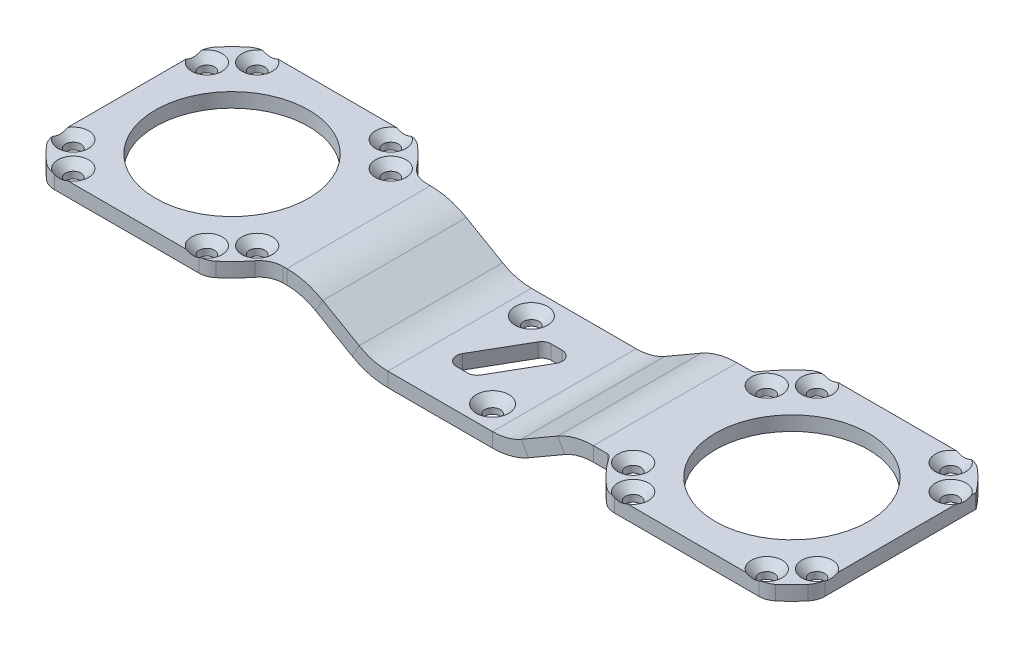
from build123d import *

# Parameters (mm, degrees)
SM_BASE_FLANGE_3_DEPTH       = 3
OTHER_START                  = -3
OTHER_2_DEPTH                = 3
OTHER_START_2                = 5
OTHER_2_2_DEPTH              = 3
OTHER_START_3                = -22
OTHER_2_3_DEPTH              = 44
OTHER_START_4                = -15
OTHER_2_4_DEPTH              = 30
OTHER_START_5                = -4
OTHER_2_5_DEPTH              = 9
OTHER_2_6_DEPTH              = 3
OTHER_2_7_DEPTH              = 3
SKETCH_15_R                  = 16
CUT_EXTRUDE_1_DEPTH          = 50
OTHER_4_DEPTH                = 44
OTHER_4_2_DEPTH              = 44
OTHER_START_6                = -11
OTHER_4_3_OUTLINE_R          = 16
OTHER_4_3_DEPTH              = 11
SKETCH_31_R                  = 1.4
CUT_EXTRUDE_2_DEPTH          = 10
CUT_EXTRUDE_5_DEPTH          = 56
FILLET_2_R                   = 2
FILLET_7_R                   = 4
FILLET_8_R                   = 5
FILLET_9_R                   = 1
SKETCH_45_R                  = 1.6
CUT_EXTRUDE_6_DEPTH          = 10
HOLE_WIZARD_M3_3_D           = 3.2
HOLE_WIZARD_M3_3_DEPTH       = 3
HOLE_WIZARD_M3_3_CSINK_D     = 6.4
HOLE_WIZARD_M3_3_CSINK_ANGLE = 90
HOLE_WIZARD_M3_3_TIP         = 0.96137699
HOLE_WIZARD_M3_2_D           = 3.2
HOLE_WIZARD_M3_2_DEPTH       = 3.3
HOLE_WIZARD_M3_2_CSINK_D     = 6.8
HOLE_WIZARD_M3_2_CSINK_ANGLE = 90
HOLE_WIZARD_M3_2_TIP         = 0.96137699


with BuildPart() as part:
    # 基体-法兰3: sheet metal written as solids
    # Sketch 1 → 基体-法兰3 (new body)
    with BuildSketch(Plane(origin=(0, 0, 0), x_dir=(1, 0, 0), z_dir=(0, 1, 0))):
        with BuildLine():
            Line((23.048861143, 15), (93.951138857, 15))
            ThreePointArc((93.951138857, 15), (96.91821461, 18.787546289), (100.5, 22))
            Line((100.5, 22), (133.5, 22))
            ThreePointArc((133.5, 22), (136.445436483, 19.445436483), (139, 16.5))
            Line((139, 16.5), (139, -16.5))
            ThreePointArc((139, -16.5), (136.445436483, -19.445436483), (133.5, -22))
            Line((133.5, -22), (100.5, -22))
            ThreePointArc((100.5, -22), (96.91821461, -18.787546289), (93.951138857, -15))
            Line((93.951138857, -15), (23.048861143, -15))
            ThreePointArc((23.048861143, -15), (20.08178539, -18.787546289), (16.5, -22))
            Line((16.5, -22), (-16.5, -22))
            ThreePointArc((-16.5, -22), (-19.445436483, -19.445436483), (-22, -16.5))
            Line((-22, -16.5), (-22, 16.5))
            ThreePointArc((-22, 16.5), (-19.445436483, 19.445436483), (-16.5, 22))
            Line((-16.5, 22), (16.5, 22))
            ThreePointArc((16.5, 22), (20.08178539, 18.787546289), (23.048861143, 15))
        make_face()
    extrude(amount=-SM_BASE_FLANGE_3_DEPTH)

    # Other 2: read off the stored shape, not the designer's step
    # Other 2 outline → Other 2 (cut)
    with BuildSketch(Plane(origin=(0, 0, 0), x_dir=(1, 0, 0), z_dir=(0, 1, 0)).offset(OTHER_START)):
        with BuildLine():
            ThreePointArc((-20.188495911, 16.5), (-17.633932394, 19.445436482), (-14.688495911, 22))
            Line((-14.688495911, 22), (-16.5, 22))
            ThreePointArc((-16.5, 22), (-19.445436483, 19.445436483), (-22, 16.5))
            Line((-22, 16.5), (-22, -16.5))
            ThreePointArc((-22, -16.5), (-19.445436483, -19.445436483), (-16.5, -22))
            Line((-16.5, -22), (-14.688495911, -22))
            ThreePointArc((-14.688495911, -22), (-17.633932393, -19.445436482), (-20.188495911, -16.5))
            Line((-20.188495911, -16.5), (-20.188495911, 16.5))
        make_face()
    extrude(amount=OTHER_2_DEPTH, mode=Mode.SUBTRACT)

    # Other 2 3 outline → Other 2 3 (cut)
    with BuildSketch(Plane.XY.offset(OTHER_START_3)):
        with BuildLine():
            Line((41.86824701, -0.990381057), (40.1528567, 0))
            Line((40.1528567, 0), (-20.188495911, 0))
            Line((-20.188495911, 0), (-20.188495911, -3))
            Line((-20.188495911, -3), (49.36824701, -3))
            ThreePointArc((49.36824701, -3), (45.485961334, -2.488887394), (41.86824701, -0.990381057))
        make_face()
    extrude(amount=OTHER_2_3_DEPTH, mode=Mode.SUBTRACT)



with BuildPart() as body_2:
    # Other 2 2 outline → Other 2 2 (new body)
    with BuildSketch(Plane(origin=(0, 0, 0), x_dir=(1, 0, 0), z_dir=(0, 1, 0)).offset(OTHER_START_2)):
        with BuildLine():
            Line((23.048861143, 15), (24.860365233, 15))
            ThreePointArc((24.860365233, 15), (21.893289479, 18.787546289), (18.311504089, 22))
            Line((18.311504089, 22), (16.5, 22))
            ThreePointArc((16.5, 22), (20.08178539, 18.787546289), (23.048861143, 15))
        make_face()
        with BuildLine():
            ThreePointArc((23.048861143, -15), (20.08178539, -18.787546289), (16.5, -22))
            Line((16.5, -22), (18.311504089, -22))
            ThreePointArc((18.311504089, -22), (21.893289479, -18.787546289), (24.860365233, -15))
            Line((24.860365233, -15), (23.048861143, -15))
        make_face()
    extrude(amount=OTHER_2_2_DEPTH)


with BuildPart() as part_1:
    add(part.part)

    add(body_2.part)  # Other 2 4 merges body 2
    # Other 2 4 outline → Other 2 4 (add)
    with BuildSketch(Plane.XY.offset(OTHER_START_4)):
        with BuildLine():
            ThreePointArc((49.36824701, 0), (46.262418469, 0.408890085), (43.36824701, 1.607695155))
            Line((43.36824701, 1.607695155), (35.777212354, 5.990381057))
            ThreePointArc((35.777212354, 5.990381057), (32.15949803, 7.488887394), (28.277212354, 8))
            Line((28.277212354, 8), (-20.188495911, 8))
            Line((-20.188495911, 8), (-20.188495911, 5))
            Line((-20.188495911, 5), (28.277212354, 5))
            ThreePointArc((28.277212354, 5), (31.383040895, 4.591109915), (34.277212354, 3.392304845))
            Line((34.277212354, 3.392304845), (40.1528567, 0))
            Line((40.1528567, 0), (49.36824701, 0))
        make_face()
    extrude(amount=OTHER_2_4_DEPTH)

    # Other 2 5 outline → Other 2 5 (cut)
    with BuildSketch(Plane(origin=(0, 0, 0), x_dir=(1, 0, 0), z_dir=(0, 1, 0)).offset(OTHER_START_5)):
        with BuildLine():
            ThreePointArc((100.5, 22), (96.91821461, 18.787546289), (93.951138857, 15))
            Line((93.951138857, 15), (95.762642946, 15))
            ThreePointArc((95.762642946, 15), (98.7297187, 18.787546289), (102.311504089, 22))
            Line((102.311504089, 22), (100.5, 22))
        make_face()
        with BuildLine():
            Line((95.762642946, -15), (93.951138857, -15))
            ThreePointArc((93.951138857, -15), (96.91821461, -18.787546289), (100.5, -22))
            Line((100.5, -22), (102.311504089, -22))
            ThreePointArc((102.311504089, -22), (98.7297187, -18.787546289), (95.762642946, -15))
        make_face()
    extrude(amount=OTHER_2_5_DEPTH, mode=Mode.SUBTRACT)

    # Other 2 6 outline → Other 2 6 (add)
    with BuildSketch(Plane(origin=(0, 0, 0), x_dir=(1, 0, 0), z_dir=(0, 1, 0)).offset(OTHER_START_2)):
        with BuildLine():
            Line((16.5, 22), (-14.688495911, 22))
            ThreePointArc((-14.688495911, 22), (-17.633932394, 19.445436482), (-20.188495911, 16.5))
            Line((-20.188495911, 16.5), (-20.188495911, 15))
            Line((-20.188495911, 15), (23.048861143, 15))
            ThreePointArc((23.048861143, 15), (20.08178539, 18.787546289), (16.5, 22))
        make_face()
        with BuildLine():
            Line((23.048861143, -15), (-20.188495911, -15))
            Line((-20.188495911, -15), (-20.188495911, -16.5))
            ThreePointArc((-20.188495911, -16.5), (-17.633932393, -19.445436482), (-14.688495911, -22))
            Line((-14.688495911, -22), (16.5, -22))
            ThreePointArc((16.5, -22), (20.08178539, -18.787546289), (23.048861143, -15))
        make_face()
    extrude(amount=OTHER_2_6_DEPTH)

    # Other 2 7 outline → Other 2 7 (add)
    with BuildSketch(Plane(origin=(0, 0, 0), x_dir=(1, 0, 0), z_dir=(0, 1, 0)).offset(OTHER_START)):
        with BuildLine():
            Line((135.311504089, 22), (133.5, 22))
            ThreePointArc((133.5, 22), (136.445436483, 19.445436483), (139, 16.5))
            Line((139, 16.5), (139, -16.5))
            ThreePointArc((139, -16.5), (136.445436483, -19.445436483), (133.5, -22))
            Line((133.5, -22), (135.311504089, -22))
            ThreePointArc((135.311504089, -22), (138.256940572, -19.445436483), (140.811504089, -16.5))
            Line((140.811504089, -16.5), (140.811504089, 16.5))
            ThreePointArc((140.811504089, 16.5), (138.256940572, 19.445436483), (135.311504089, 22))
        make_face()
    extrude(amount=OTHER_2_7_DEPTH)

    # 草图15 → 切除-拉伸1 (cut)
    with BuildSketch(Plane(origin=(0, 8, 0), x_dir=(1, 0, 0), z_dir=(0, 1, 0))):
        with Locations(Location((118.811504089, 0, 0), (0, 0, 270))):
            Circle(SKETCH_15_R)
        with Locations(Location((1.811504089, 0, 0), (0, 0, 270))):
            Circle(SKETCH_15_R)
    extrude(amount=-CUT_EXTRUDE_1_DEPTH, mode=Mode.SUBTRACT)

    # Other 4: read off the stored shape, not the designer's step
    # Other 4 outline → Other 4 (cut)
    with BuildSketch(Plane.XY.offset(OTHER_START_3)):
        with BuildLine():
            Line((49.36824701, -3), (83.130405515, -3))
            Line((83.130405515, -3), (84.845795825, -2.009618943))
            ThreePointArc((84.845795825, -2.009618943), (88.463510149, -0.511112606), (92.345795825, 0))
            Line((92.345795825, 0), (49.36824701, 0))
            ThreePointArc((49.36824701, 0), (46.262418469, 0.408890085), (43.36824701, 1.607695155))
            Line((43.36824701, 1.607695155), (35.777212354, 5.990381057))
            ThreePointArc((35.777212354, 5.990381057), (32.15949803, 7.488887394), (28.277212354, 8))
            Line((28.277212354, 8), (-20.188495911, 8))
            Line((-20.188495911, 8), (-20.188495911, 5))
            Line((-20.188495911, 5), (28.277212354, 5))
            ThreePointArc((28.277212354, 5), (31.383040895, 4.591109915), (34.277212354, 3.392304845))
            Line((34.277212354, 3.392304845), (41.86824701, -0.990381057))
            ThreePointArc((41.86824701, -0.990381057), (45.485961334, -2.488887394), (49.36824701, -3))
        make_face()
    extrude(amount=OTHER_4_DEPTH, mode=Mode.SUBTRACT)

    # Other 4 2 outline → Other 4 2 (add)
    with BuildSketch(Plane.XY.offset(OTHER_START_3)):
        with BuildLine():
            ThreePointArc((77.254761168, -6.392304845), (74.360589709, -7.591109915), (71.254761168, -8))
            Line((71.254761168, -8), (49.36824701, -8))
            ThreePointArc((49.36824701, -8), (46.262418469, -7.591109915), (43.36824701, -6.392304845))
            Line((43.36824701, -6.392304845), (35.777212354, -2.009618943))
            ThreePointArc((35.777212354, -2.009618943), (32.15949803, -0.511112606), (28.277212354, 0))
            Line((28.277212354, 0), (-20.188495911, 0))
            Line((-20.188495911, 0), (-20.188495911, -3))
            Line((-20.188495911, -3), (28.277212354, -3))
            ThreePointArc((28.277212354, -3), (31.383040895, -3.408890085), (34.277212354, -4.607695155))
            Line((34.277212354, -4.607695155), (41.86824701, -8.990381057))
            ThreePointArc((41.86824701, -8.990381057), (45.485961334, -10.488887394), (49.36824701, -11))
            Line((49.36824701, -11), (71.254761168, -11))
            ThreePointArc((71.254761168, -11), (75.137046844, -10.488887394), (78.754761168, -8.990381057))
            Line((78.754761168, -8.990381057), (86.345795825, -4.607695155))
            ThreePointArc((86.345795825, -4.607695155), (89.239967284, -3.408890085), (92.345795825, -3))
            Line((92.345795825, -3), (83.130405515, -3))
            Line((83.130405515, -3), (77.254761168, -6.392304845))
        make_face()
    extrude(amount=OTHER_4_2_DEPTH)

    # Other 4 3 outline → Other 4 3 (cut)
    with BuildSketch(Plane(origin=(0, 0, 0), x_dir=(1, 0, 0), z_dir=(0, 1, 0)).offset(OTHER_START_6)):
        with BuildLine():
            Line((94, -15), (24.860365233, -15))
            ThreePointArc((24.860365233, -15), (21.893289479, -18.787546289), (18.311504089, -22))
            Line((18.311504089, -22), (94, -22))
            Line((94, -22), (94, -15))
        make_face()
        with Locations((1.811504089, 0)):
            Circle(OTHER_4_3_OUTLINE_R)
        with BuildLine():
            Line((24.860365233, 15), (94, 15))
            Line((94, 15), (94, 22))
            Line((94, 22), (18.311504089, 22))
            ThreePointArc((18.311504089, 22), (21.893289479, 18.787546289), (24.860365233, 15))
        make_face()
        with BuildLine():
            Line((-20.188495911, -22), (-14.688495911, -22))
            ThreePointArc((-14.688495911, -22), (-17.633932393, -19.445436482), (-20.188495911, -16.5))
            Line((-20.188495911, -16.5), (-20.188495911, -22))
        make_face()
        with BuildLine():
            Line((-20.188495911, 22), (-20.188495911, 16.5))
            ThreePointArc((-20.188495911, 16.5), (-17.633932394, 19.445436482), (-14.688495911, 22))
            Line((-14.688495911, 22), (-20.188495911, 22))
        make_face()
    extrude(amount=OTHER_4_3_DEPTH, mode=Mode.SUBTRACT)

    # 草图31 → 切除-拉伸2 (cut)
    with BuildSketch(Plane(origin=(0, 0, 0), x_dir=(1, 0, 0), z_dir=(0, 1, 0))):
        with Locations(Location((-12.148395653, 19.214153616, 0), (0, 0, 270))):
            Circle(SKETCH_31_R)
        with Locations(Location((-17.402649527, 13.959899742, 0), (0, 0, 270))):
            Circle(SKETCH_31_R)
        with Locations(Location((21.025657706, 13.959899742, 0), (0, 0, 270))):
            Circle(SKETCH_31_R)
        with Locations(Location((15.771403831, 19.214153616, 0), (0, 0, 270))):
            Circle(SKETCH_31_R)
        with Locations(Location((21.025657706, -13.959899742, 0), (0, 0, 270))):
            Circle(SKETCH_31_R)
        with Locations(Location((15.771403831, -19.214153616, 0), (0, 0, 270))):
            Circle(SKETCH_31_R)
        with Locations(Location((-17.402649527, -13.959899742, 0), (0, 0, 270))):
            Circle(SKETCH_31_R)
        with Locations(Location((-12.148395653, -19.214153616, 0), (0, 0, 270))):
            Circle(SKETCH_31_R)
        with Locations(Location((132.771403831, -19.214153616, 0), (0, 0, 270))):
            Circle(SKETCH_31_R)
        with Locations(Location((138.025657706, -13.959899742, 0), (0, 0, 270))):
            Circle(SKETCH_31_R)
        with Locations(Location((104.851604347, -19.214153616, 0), (0, 0, 270))):
            Circle(SKETCH_31_R)
        with Locations(Location((99.597350473, -13.959899742, 0), (0, 0, 270))):
            Circle(SKETCH_31_R)
        with Locations(Location((104.851604347, 19.214153616, 0), (0, 0, 270))):
            Circle(SKETCH_31_R)
        with Locations(Location((99.597350473, 13.959899742, 0), (0, 0, 270))):
            Circle(SKETCH_31_R)
        with Locations(Location((138.025657706, 13.959899742, 0), (0, 0, 270))):
            Circle(SKETCH_31_R)
        with Locations(Location((132.771403831, 19.214153616, 0), (0, 0, 270))):
            Circle(SKETCH_31_R)
    extrude(amount=-CUT_EXTRUDE_2_DEPTH, mode=Mode.SUBTRACT)

    # 草图36 → 切除-拉伸5 (cut)
    with BuildSketch(Plane(origin=(0, -8, 0), x_dir=(1, 0, 0), z_dir=(0, 1, 0))):
        Polygon((52.270052205, -7), (60.352955974, 7), (67.281159204, 7), (59.198255435, -7), align=None)
    extrude(amount=-CUT_EXTRUDE_5_DEPTH, mode=Mode.SUBTRACT)

    # 圆角2
    fillet_2_edges = [part_1.edges().sort_by_distance(p)[0] for p in [
        (60.352955974, -9.5, -7),
        (67.281159204, -9.5, -7),
        (59.198255435, -9.5, 7),
        (52.270052205, -9.5, 7),
    ]]
    fillet(fillet_2_edges, radius=FILLET_2_R)

    # 圆角7
    fillet_7_edges = [part_1.edges().sort_by_distance(p)[0] for p in [
        (18.311504089, -1.5, -22),
        (-14.688495911, -1.5, -22),
        (-20.188495911, -1.5, -16.5),
        (-20.188495911, -1.5, 16.5),
        (-14.688495911, -1.5, 22),
        (18.311504089, -1.5, 22),
        (102.311504089, -1.5, 22),
        (135.311504089, -1.5, 22),
        (140.811504089, -1.5, 16.5),
        (135.311504089, -1.5, -22),
        (102.311504089, -1.5, -22),
    ]]
    fillet(fillet_7_edges, radius=FILLET_7_R)

    # 圆角8
    fillet_8_edges = [part_1.edges().sort_by_distance(p)[0] for p in [
        (24.860365233, -1.5, 15),
        (24.860365233, -1.5, -15),
    ]]
    fillet(fillet_8_edges, radius=FILLET_8_R)

    # 圆角9
    fillet_9_edges = [part_1.edges().sort_by_distance(p)[0] for p in [
        (95.762642946, -1.5, -15),
        (95.762642946, -1.5, 15),
    ]]
    fillet(fillet_9_edges, radius=FILLET_9_R)

    # 草图45 → 切除-拉伸6 (cut)
    with BuildSketch(Plane(origin=(0, -8, 0), x_dir=(1, 0, 0), z_dir=(0, 1, 0))):
        with Locations(Location((66.254761168, -10, 0), (0, 0, 270))):
            Circle(SKETCH_45_R)
        with Locations(Location((54.36824701, 10, 0), (0, 0, 270))):
            Circle(SKETCH_45_R)
    extrude(amount=-CUT_EXTRUDE_6_DEPTH, mode=Mode.SUBTRACT)

    # M3 十字槽半沉头木螺钉的锥形沉头孔3
    with Locations(Plane(origin=(-12.148395653, 0, -19.214153616), x_dir=(0, 0, 1), z_dir=(0, 1, 0))):
        with Locations((0, 0), (5.254253874, -5.254253874), (0, 27.919799484), (5.254253874, 33.174053359), (33.174053358, 33.174053359), (38.428307232, 27.919799484), (33.174053358, -5.254253874), (38.428307232, 0), (0, 117), (5.254253874, 111.745746126), (33.174053358, 111.745746126), (38.428307232, 117), (38.428307232, 144.919799484), (33.174053358, 150.174053359), (0, 144.919799484), (5.254253874, 150.174053359)):
            CounterSinkHole(HOLE_WIZARD_M3_3_D / 2, HOLE_WIZARD_M3_3_CSINK_D / 2, depth=HOLE_WIZARD_M3_3_DEPTH, counter_sink_angle=HOLE_WIZARD_M3_3_CSINK_ANGLE)
            with Locations((0, 0, -(HOLE_WIZARD_M3_3_DEPTH + HOLE_WIZARD_M3_3_TIP / 2))):  # 118° drill point
                Cone(0, HOLE_WIZARD_M3_3_D / 2, HOLE_WIZARD_M3_3_TIP, mode=Mode.SUBTRACT)

    # M3 十字槽半沉头木螺钉的锥形沉头孔2
    with Locations(Plane(origin=(0, -8, 0), x_dir=(1, 0, 0), z_dir=(0, 1, 0))):
        with Locations((66.254761168, -10), (54.36824701, 10)):
            CounterSinkHole(HOLE_WIZARD_M3_2_D / 2, HOLE_WIZARD_M3_2_CSINK_D / 2, depth=HOLE_WIZARD_M3_2_DEPTH, counter_sink_angle=HOLE_WIZARD_M3_2_CSINK_ANGLE)
            with Locations((0, 0, -(HOLE_WIZARD_M3_2_DEPTH + HOLE_WIZARD_M3_2_TIP / 2))):  # 118° drill point
                Cone(0, HOLE_WIZARD_M3_2_D / 2, HOLE_WIZARD_M3_2_TIP, mode=Mode.SUBTRACT)


solid = part_1.part
